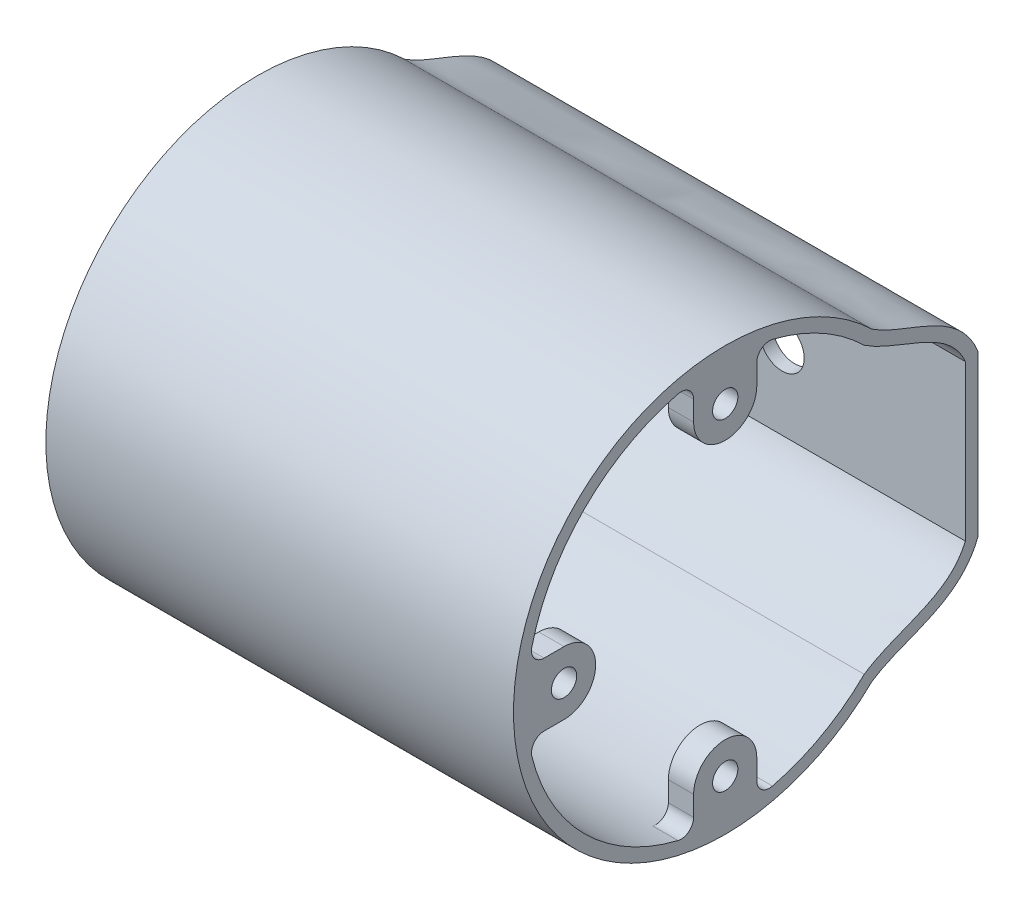
from build123d import *

# Parameters (mm, degrees)
EXTRUDE_THIN3_DEPTH = 70
CUT_EXTRUDE2_REACH  = 109.521
SKETCH14_R          = 3.5
BOSS_EXTRUDE2_DEPTH = 4
CUT_EXTRUDE3_REACH  = 111.562
SKETCH16_R          = 2


# Read off the part's stored shape, not the designer's step: Extrude-Thin3
with BuildPart() as part:
    # Extrude-Thin3 outline → Extrude-Thin3 (new body)
    with BuildSketch(Plane(origin=(0, 0, 0), x_dir=(0, 0, -1), z_dir=(1, 0, 0))):
        with BuildLine():
            Line((0.909061836, -14.669862969), (0.909061836, 10.720277827))
            add(Edge.make_bspline(
                [(0.909061836, 10.720277827), (0.826807355, 10.923087932), (0.744181279, 11.125656518), (0.56557007, 11.522110942), (0.471224829, 11.717062632), (0.172894413, 12.291976881), (-0.046398469, 12.661990163), (-0.526461943, 13.3750582), (-0.787239132, 13.718108666), (-1.350452209, 14.377133437), (-1.655192648, 14.695127232), (-2.611741239, 15.59168673), (-3.302902398, 16.112815322), (-4.761466671, 17.045865484), (-5.53142089, 17.458814961), (-7.892254177, 18.588450633), (-9.528253043, 19.196215177), (-11.954588006, 20.171146985), (-12.758502474, 20.50618552), (-14.330984575, 21.249380319), (-15.099811003, 21.657001246), (-15.833853889, 22.136574686)],
                knots=[0, 0, 0, 0, 0.03125, 0.03125, 0.0625, 0.0625, 0.125, 0.125, 0.1875, 0.1875, 0.25, 0.25, 0.375, 0.375, 0.5, 0.5, 0.75, 0.75, 0.875, 0.875, 1, 1, 1, 1], degree=3))
            ThreePointArc((-15.833853889, 22.136574686), (-72.590938164, -1.974792572), (-15.833853889, -26.086159829))
            add(Edge.make_bspline(
                [(-15.833853889, -26.086159829), (-15.100496012, -25.607033927), (-14.33307243, -25.200103061), (-12.764214382, -24.458320177), (-11.962517255, -24.124024817), (-9.543078024, -23.151545958), (-7.91051316, -22.544836021), (-5.561104569, -21.423547872), (-4.79446395, -21.014741551), (-3.318943636, -20.074420204), (-2.625372945, -19.551564831), (-1.676371211, -18.665750443), (-1.375044416, -18.353480395), (-0.805721249, -17.691186874), (-0.538297709, -17.341162489), (-0.051350693, -16.619956398), (0.170067695, -16.246729246), (0.470274569, -15.668617459), (0.565026353, -15.472870038), (0.74411778, -15.075415403), (0.826777522, -14.872746631), (0.909061836, -14.669862969)],
                knots=[0, 0, 0, 0, 0.125, 0.125, 0.25, 0.25, 0.5, 0.5, 0.625, 0.625, 0.75, 0.75, 0.8125, 0.8125, 0.875, 0.875, 0.9375, 0.9375, 0.96875, 0.96875, 1, 1, 1, 1], degree=3))
        make_face()
        with BuildLine():
            add(Edge.make_bspline(
                [(-1.090938164, 10.325407182), (-1.412619551, 11.077844383), (-1.818903118, 11.773335552), (-2.560343937, 12.727712215), (-2.82988586, 13.031635411), (-3.409343177, 13.608690849), (-3.714063514, 13.876920015), (-4.665569169, 14.631043316), (-5.350730703, 15.067277009), (-6.778514977, 15.852248881), (-7.51323501, 16.197307873), (-9.746388539, 17.166464268), (-11.274315356, 17.725239814), (-13.519666401, 18.662442973), (-14.260301039, 18.990774084), (-15.345466848, 19.53582833), (-15.702879517, 19.72629627), (-16.406506385, 20.130056979), (-16.751779952, 20.345266955), (-17.092044079, 20.57068722)],
                knots=[0, 0, 0, 0, 0.125, 0.125, 0.1875, 0.1875, 0.25, 0.25, 0.375, 0.375, 0.5, 0.5, 0.75, 0.75, 0.875, 0.875, 0.9375, 0.9375, 1, 1, 1, 1], degree=3))
            Line((-1.090938164, 10.325407182), (-1.090938164, -14.274992324))
            add(Edge.make_bspline(
                [(-17.092044079, -24.520272363), (-16.75212318, -24.295079481), (-16.407083703, -24.079991441), (-15.70360059, -23.676277181), (-15.346119507, -23.485750739), (-14.260396239, -22.940388161), (-13.518917037, -22.611683886), (-11.270338851, -21.673228184), (-9.742212218, -21.11454584), (-7.505722666, -20.143477325), (-6.769494687, -19.796998712), (-5.355263551, -19.019229951), (-4.67562832, -18.587497232), (-3.723670077, -17.834658118), (-3.416539548, -17.564934821), (-2.835052735, -16.986863036), (-2.565424759, -16.68332576), (-1.821919986, -15.727813675), (-1.413961463, -15.03056836), (-1.090938164, -14.274992324)],
                knots=[0, 0, 0, 0, 0.0625, 0.0625, 0.125, 0.125, 0.25, 0.25, 0.5, 0.5, 0.625, 0.625, 0.75, 0.75, 0.8125, 0.8125, 0.875, 0.875, 1, 1, 1, 1], degree=3))
            ThreePointArc((-17.092044079, -24.520272363), (-70.590938164, -1.974792572), (-17.092044079, 20.57068722))
        make_face(mode=Mode.SUBTRACT)
    extrude(amount=EXTRUDE_THIN3_DEPTH)

    # Sketch14 → Cut-Extrude2 (cut, up to next)
    with BuildSketch(Plane(origin=(0, 0, -0.909061836), x_dir=(-1, 0, 0), z_dir=(0, 0, -1)), mode=Mode.PRIVATE) as cut_extrude2_sk1:
        with Locations(Location((-45, -1.974792571, 0), (0, 0, 90))):
            Circle(SKETCH14_R)
    cut_extrude2_tool1 = extrude(cut_extrude2_sk1.sketch, amount=-CUT_EXTRUDE2_REACH, mode=Mode.PRIVATE) & part.part
    add(cut_extrude2_tool1.solids().sort_by_distance((45, -1.974793, -0.909062))[0], mode=Mode.SUBTRACT)

    # Sketch15 → Boss-Extrude2 (add)
    # profile 1 of 4: a face of its own
    with BuildSketch(Plane(origin=(70, 0, 0), x_dir=(0, 0, -1), z_dir=(1, 0, 0))):
        with BuildLine():
            Line((0.909061836, -14.669862969), (0.909061836, 10.720277827))
            add(Edge.make_bspline(
                [(0.909061836, 10.720277827), (0.826807355, 10.923087932), (0.744181279, 11.125656518), (0.56557007, 11.522110942), (0.471224829, 11.717062632), (0.172894413, 12.291976881), (-0.046398469, 12.661990163), (-0.526461943, 13.3750582), (-0.787239132, 13.718108666), (-1.350452209, 14.377133437), (-1.655192648, 14.695127232), (-2.611741239, 15.59168673), (-3.302902398, 16.112815322), (-4.761466671, 17.045865484), (-5.53142089, 17.458814961), (-7.892254177, 18.588450633), (-9.528253043, 19.196215177), (-11.954588006, 20.171146985), (-12.758502474, 20.50618552), (-14.330984575, 21.249380319), (-15.099811003, 21.657001246), (-15.833853889, 22.136574686)],
                knots=[0, 0, 0, 0, 0.03125, 0.03125, 0.0625, 0.0625, 0.125, 0.125, 0.1875, 0.1875, 0.25, 0.25, 0.375, 0.375, 0.5, 0.5, 0.75, 0.75, 0.875, 0.875, 1, 1, 1, 1], degree=3))
            ThreePointArc((-15.833853889, 22.136574686), (-72.590938164, -1.974792571), (-15.833853889, -26.086159829))
            add(Edge.make_bspline(
                [(-15.833853889, -26.086159829), (-15.100496012, -25.607033927), (-14.33307243, -25.200103061), (-12.764214382, -24.458320177), (-11.962517255, -24.124024817), (-9.543078024, -23.151545958), (-7.91051316, -22.544836021), (-5.561104569, -21.423547872), (-4.79446395, -21.014741551), (-3.318943636, -20.074420204), (-2.625372945, -19.551564831), (-1.676371211, -18.665750443), (-1.375044416, -18.353480395), (-0.805721249, -17.691186874), (-0.538297709, -17.341162489), (-0.051350693, -16.619956398), (0.170067695, -16.246729246), (0.470274569, -15.668617459), (0.565026353, -15.472870038), (0.74411778, -15.075415403), (0.826777522, -14.872746631), (0.909061836, -14.669862969)],
                knots=[0, 0, 0, 0, 0.125, 0.125, 0.25, 0.25, 0.5, 0.5, 0.625, 0.625, 0.75, 0.75, 0.8125, 0.8125, 0.875, 0.875, 0.9375, 0.9375, 0.96875, 0.96875, 1, 1, 1, 1], degree=3))
        make_face()
        with BuildLine():
            ThreePointArc((-17.092044079, -24.520272363), (-70.590938164, -1.974792571), (-17.092044079, 20.57068722))
            add(Edge.make_bspline(
                [(-17.092044079, 20.57068722), (-16.751779952, 20.345266955), (-16.406506385, 20.130056979), (-15.702879517, 19.72629627), (-15.345466848, 19.53582833), (-14.260301039, 18.990774084), (-13.519666401, 18.662442973), (-11.274315356, 17.725239814), (-9.746388539, 17.166464268), (-7.51323501, 16.197307873), (-6.778514977, 15.852248881), (-5.350730703, 15.067277009), (-4.665569169, 14.631043316), (-3.714063514, 13.876920015), (-3.409343177, 13.608690849), (-2.82988586, 13.031635411), (-2.560343937, 12.727712215), (-1.818903118, 11.773335552), (-1.412619551, 11.077844383), (-1.090938164, 10.325407182)],
                knots=[0, 0, 0, 0, 0.0625, 0.0625, 0.125, 0.125, 0.25, 0.25, 0.5, 0.5, 0.625, 0.625, 0.75, 0.75, 0.8125, 0.8125, 0.875, 0.875, 1, 1, 1, 1], degree=3))
            Line((-1.090938164, 10.325407182), (-1.090938164, -14.274992324))
            add(Edge.make_bspline(
                [(-1.090938164, -14.274992324), (-1.413961463, -15.03056836), (-1.821919986, -15.727813675), (-2.565424759, -16.68332576), (-2.835052735, -16.986863036), (-3.416539548, -17.564934821), (-3.723670077, -17.834658118), (-4.67562832, -18.587497232), (-5.355263551, -19.019229951), (-6.769494687, -19.796998712), (-7.505722666, -20.143477325), (-9.742212218, -21.11454584), (-11.270338851, -21.673228184), (-13.518917037, -22.611683886), (-14.260396239, -22.940388161), (-15.346119507, -23.485750739), (-15.70360059, -23.676277181), (-16.407083703, -24.079991441), (-16.75212318, -24.295079481), (-17.092044079, -24.520272363)],
                knots=[0, 0, 0, 0, 0.125, 0.125, 0.1875, 0.1875, 0.25, 0.25, 0.375, 0.375, 0.5, 0.5, 0.75, 0.75, 0.875, 0.875, 0.9375, 0.9375, 1, 1, 1, 1], degree=3))
        make_face(mode=Mode.SUBTRACT)
    # profile 2 of 4: a face of its own
    with BuildSketch(Plane(origin=(70, 0, 0), x_dir=(0, 0, -1), z_dir=(1, 0, 0))):
        with BuildLine():
            ThreePointArc((-67.748397926, 3.025207429), (-69.321476522, 3.790126974), (-69.691276554, 5.4997837))
            ThreePointArc((-69.691276554, 5.4997837), (-70.590938164, -1.974792571), (-69.691276554, -9.449368842))
            ThreePointArc((-69.691276554, -9.449368842), (-69.321476522, -7.739712117), (-67.748397926, -6.974792571))
            Line((-67.748397926, -6.974792571), (-64.590938164, -6.974792571))
            ThreePointArc((-64.590938164, -6.974792571), (-59.590938164, -1.974792571), (-64.590938164, 3.025207429))
            Line((-64.590938164, 3.025207429), (-67.748397926, 3.025207429))
        make_face()
    # profile 3 of 4: a face of its own
    with BuildSketch(Plane(origin=(70, 0, 0), x_dir=(0, 0, -1), z_dir=(1, 0, 0))):
        with BuildLine():
            Line((-34.090938164, 23.525207429), (-34.090938164, 26.682667191))
            ThreePointArc((-34.090938164, 26.682667191), (-33.326018618, 28.255745787), (-31.616361893, 28.625545818))
            ThreePointArc((-31.616361893, 28.625545818), (-39.090938164, 29.525207429), (-46.565514435, 28.625545818))
            ThreePointArc((-46.565514435, 28.625545818), (-44.85585771, 28.255745787), (-44.090938164, 26.682667191))
            Line((-44.090938164, 26.682667191), (-44.090938164, 23.525207429))
            ThreePointArc((-44.090938164, 23.525207429), (-39.090938164, 18.525207429), (-34.090938164, 23.525207429))
        make_face()
    # profile 4 of 4: a face of its own
    with BuildSketch(Plane(origin=(70, 0, 0), x_dir=(0, 0, -1), z_dir=(1, 0, 0))):
        with BuildLine():
            ThreePointArc((-44.090938164, -30.632252333), (-44.85585771, -32.20533093), (-46.565514435, -32.575130961))
            ThreePointArc((-46.565514435, -32.575130961), (-39.090938164, -33.474792571), (-31.616361893, -32.575130961))
            ThreePointArc((-31.616361893, -32.575130961), (-33.326018618, -32.20533093), (-34.090938164, -30.632252333))
            Line((-34.090938164, -30.632252333), (-34.090938164, -27.474792571))
            ThreePointArc((-34.090938164, -27.474792571), (-39.090938164, -22.474792571), (-44.090938164, -27.474792571))
            Line((-44.090938164, -27.474792571), (-44.090938164, -30.632252333))
        make_face()
    extrude(amount=BOSS_EXTRUDE2_DEPTH)

    # Sketch16 → Cut-Extrude3 (cut, up to next)
    with BuildSketch(Plane(origin=(74, 0, 0), x_dir=(0, 0, -1), z_dir=(1, 0, 0)), mode=Mode.PRIVATE) as cut_extrude3_sk1:
        with Locations((-64.590938164, -1.974792571)):
            Circle(SKETCH16_R)
    cut_extrude3_tool1 = extrude(cut_extrude3_sk1.sketch, amount=-CUT_EXTRUDE3_REACH, mode=Mode.PRIVATE) & part.part
    # Sketch16 → Cut-Extrude3 (cut, up to next)
    with BuildSketch(Plane(origin=(74, 0, 0), x_dir=(0, 0, -1), z_dir=(1, 0, 0)), mode=Mode.PRIVATE) as cut_extrude3_sk2:
        with Locations((-39.090938164, 23.525207429)):
            Circle(SKETCH16_R)
    cut_extrude3_tool2 = extrude(cut_extrude3_sk2.sketch, amount=-CUT_EXTRUDE3_REACH, mode=Mode.PRIVATE) & part.part
    # Sketch16 → Cut-Extrude3 (cut, up to next)
    with BuildSketch(Plane(origin=(74, 0, 0), x_dir=(0, 0, -1), z_dir=(1, 0, 0)), mode=Mode.PRIVATE) as cut_extrude3_sk3:
        with Locations((-39.090938164, -27.474792571)):
            Circle(SKETCH16_R)
    cut_extrude3_tool3 = extrude(cut_extrude3_sk3.sketch, amount=-CUT_EXTRUDE3_REACH, mode=Mode.PRIVATE) & part.part
    add(cut_extrude3_tool1.solids().sort_by_distance((74, -1.974793, 64.590938))[0], mode=Mode.SUBTRACT)
    add(cut_extrude3_tool2.solids().sort_by_distance((74, 23.525207, 39.090938))[0], mode=Mode.SUBTRACT)
    add(cut_extrude3_tool3.solids().sort_by_distance((74, -27.474793, 39.090938))[0], mode=Mode.SUBTRACT)


solid = part.part
